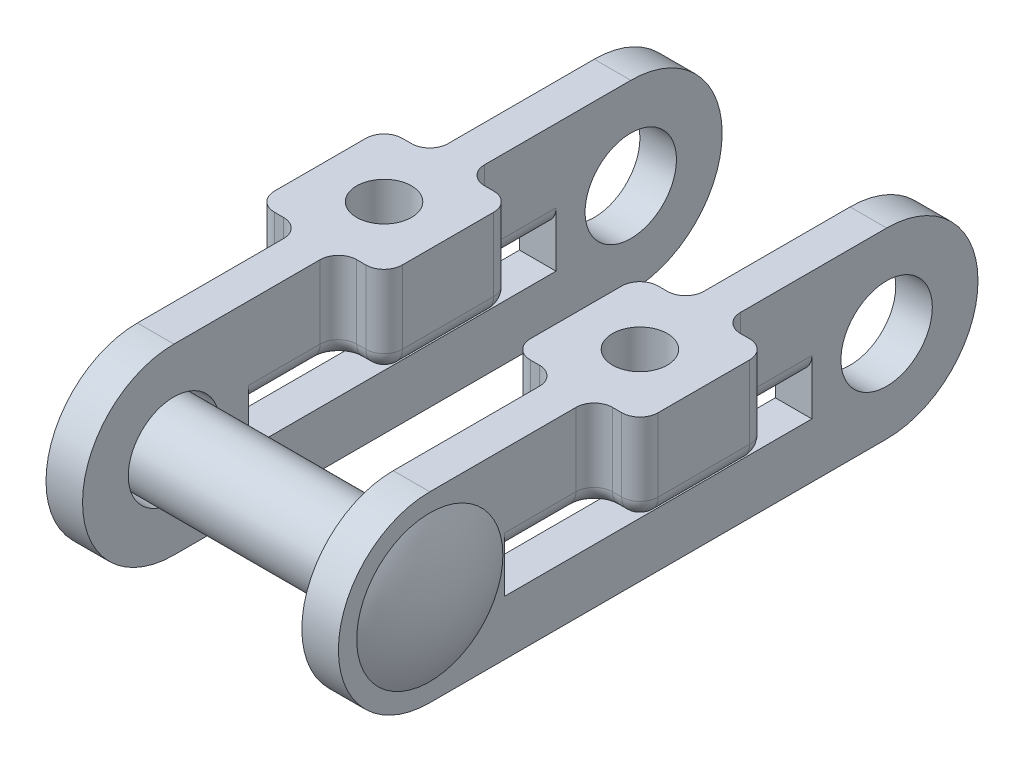
from build123d import *

# Parameters (mm, degrees)
SKETCH1_R           = 2.5
BOSS_EXTRUDE1_DEPTH = 2
SKETCH3_W           = 7
SKETCH3_H           = 7
BOSS_EXTRUDE2_DEPTH = 5
SKETCH4_R           = 1.5
CUT_EXTRUDE1_DEPTH  = 5
SKETCH5_W           = 2
SKETCH5_H           = 16.817523736
CUT_EXTRUDE2_DEPTH  = 2
FILLET1_R           = 1
FILLET2_R           = 1
LPATTERN1_COUNT     = 2
LPATTERN1_PITCH     = 14
SKETCH6_R           = 2.25
BOSS_EXTRUDE3_DEPTH = 16


with BuildPart() as part:
    # Sketch1 → Boss-Extrude1 (new body)
    with BuildSketch(Plane(origin=(0, 0, 0), x_dir=(0, 0, -1), z_dir=(1, 0, 0))):
        with BuildLine():
            Line((0, 5), (25, 5))
            ThreePointArc((25, 5), (30, 0), (25, -5))
            Line((25, -5), (0, -5))
            ThreePointArc((0, -5), (-5, 0), (0, 5))
        make_face()
        Circle(SKETCH1_R, mode=Mode.SUBTRACT)
        with Locations((25, 0)):
            Circle(SKETCH1_R, mode=Mode.SUBTRACT)
    extrude(amount=BOSS_EXTRUDE1_DEPTH)

    # Sketch3 → Boss-Extrude2 (add)
    with BuildSketch(Plane(origin=(0, 5, 0), x_dir=(1, 0, 0), z_dir=(0, 1, 0))):
        with Locations((1, 12.5)):
            Rectangle(SKETCH3_W, SKETCH3_H)
    extrude(amount=-BOSS_EXTRUDE2_DEPTH)

    # Sketch4 → Cut-Extrude1 (cut)
    with BuildSketch(Plane(origin=(0, 5, 0), x_dir=(1, 0, 0), z_dir=(0, 1, 0))):
        with Locations(Location((1, 12.5, 0), (0, 0, 270))):
            Circle(SKETCH4_R)
    extrude(amount=-CUT_EXTRUDE1_DEPTH, mode=Mode.SUBTRACT)

    # Sketch5 → Cut-Extrude2 (cut)
    with BuildSketch(Plane(origin=(0, 0, 0), x_dir=(1, 0, 0), z_dir=(0, 1, 0))):
        with Locations((1, 12.5)):
            Rectangle(SKETCH5_W, SKETCH5_H)
    extrude(amount=-CUT_EXTRUDE2_DEPTH, mode=Mode.SUBTRACT)

    # Fillet1
    fillet1_edges = [part.edges().sort_by_distance(p)[0] for p in [
        (0, 2.5, -9),
        (0, 2.5, -16),
        (-2.5, 2.5, -16),
        (4.5, 2.5, -16),
        (2, 2.5, -9),
        (4.5, 2.5, -9),
        (-2.5, 2.5, -9),
        (2, 2.5, -16),
    ]]
    fillet(fillet1_edges, radius=FILLET1_R)

    # Fillet2
    fillet2_edges = [part.edges().sort_by_distance(p)[0] for p in [
        (2, 0, -18.954380934),
        (2.292893219, 0, -16.292893219),
        (3.25, 0, -16),
        (4.207106781, 0, -15.707106781),
        (4.5, 0, -12.5),
        (4.207106781, 0, -9.292893219),
        (3.25, 0, -9),
        (2, 0, -6.045619066),
        (0, 0, -6.045619066),
        (-0.292893219, 0, -8.707106781),
        (-1.25, 0, -9),
        (-2.207106781, 0, -9.292893219),
        (-2.5, 0, -12.5),
        (-2.207106781, 0, -15.707106781),
        (-1.25, 0, -16),
        (0, 0, -18.954380934),
        (2.292893219, 0, -8.707106781),
        (-0.292893219, 0, -16.292893219),
    ]]
    fillet(fillet2_edges, radius=FILLET2_R - 0.0001)  # a hair under: the kernel refuses the full size


with BuildPart() as lpattern1_1:
    # LPattern1: pattern copy
    add(part.part.moved(Location(Vector(-1, 0, 0) * (1 * LPATTERN1_PITCH))))


with BuildPart() as body_3:
    # Sketch6 → Boss-Extrude3 (new body)
    with BuildSketch(Plane(origin=(2, 0, 0), x_dir=(0, 0, -1), z_dir=(1, 0, 0))):
        Circle(SKETCH6_R)
    extrude(amount=-BOSS_EXTRUDE3_DEPTH)

    # Sketch7<4> → Revolve3 (revolve)
    with BuildSketch(Plane(origin=(0, 0, 0), x_dir=(1, 0, 0), z_dir=(0, 1, 0)), mode=Mode.PRIVATE) as revolve3_sk:
        with BuildLine():
            Line((3, 0), (2, 0))
            Line((2, 0), (2, -4))
            ThreePointArc((2, -4), (2.746211251, -2.061552813), (3, 0))
        make_face()
    revolve(revolve3_sk.sketch.rotate(Axis((3, 0, 0), (-1, 0, 0)), 180), axis=Axis((3, 0, 0), (-1, 0, 0)))

    # Sketch7 → Revolve4 (revolve)
    with BuildSketch(Plane(origin=(0, 0, 0), x_dir=(1, 0, 0), z_dir=(0, 1, 0)), mode=Mode.PRIVATE) as revolve4_sk:
        with BuildLine():
            Line((-14, 0), (-14, -4))
            ThreePointArc((-14, -4), (-14.746211251, -2.061552813), (-15, 0))
            Line((-15, 0), (-14, 0))
        make_face()
    revolve(revolve4_sk.sketch.rotate(Axis((-15, 0, 0), (1, 0, 0)), 180), axis=Axis((-15, 0, 0), (1, 0, 0)))


solid = Compound([part.part, lpattern1_1.part, body_3.part])
